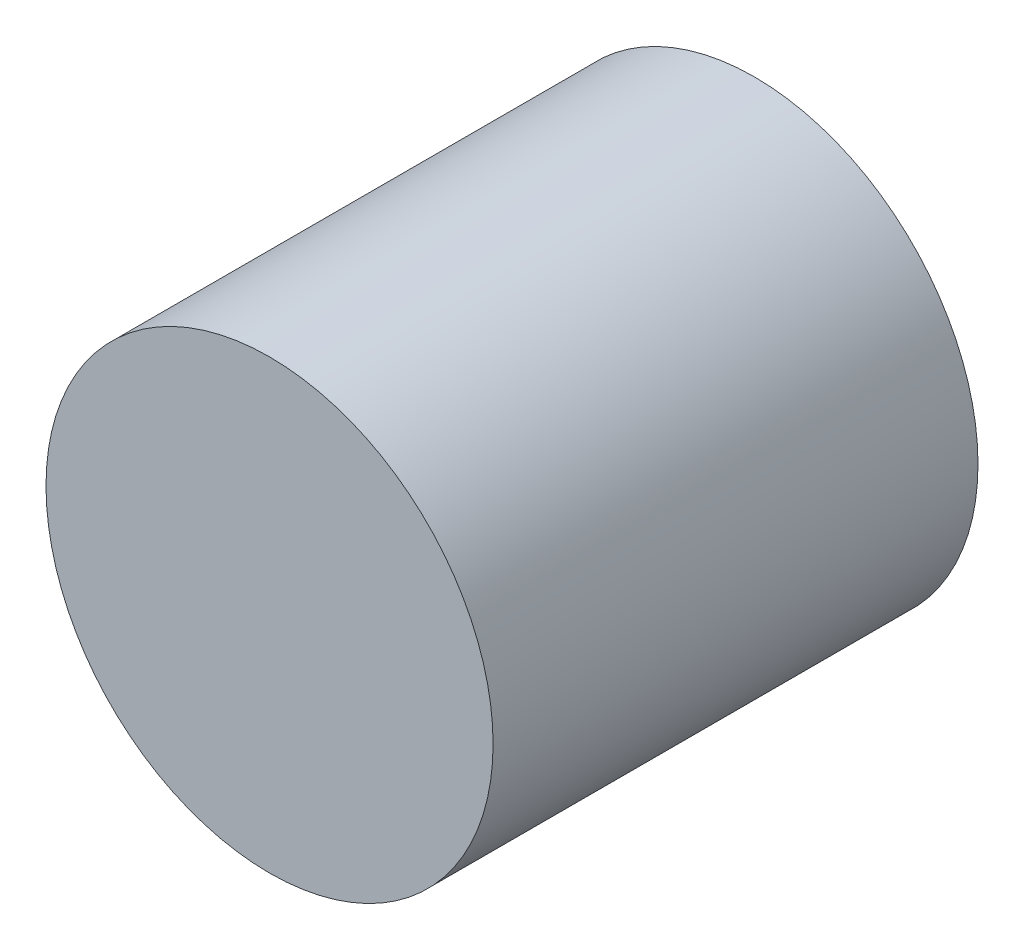
from build123d import *

# Parameters (mm, degrees)
SKETCH1_R           = 49.53
BOSS_EXTRUDE1_DEPTH = 107.442


with BuildPart() as part:
    # Sketch1 → Boss-Extrude1 (new body)
    with BuildSketch(Plane.XY):
        Circle(SKETCH1_R)
    extrude(amount=BOSS_EXTRUDE1_DEPTH)


solid = part.part
